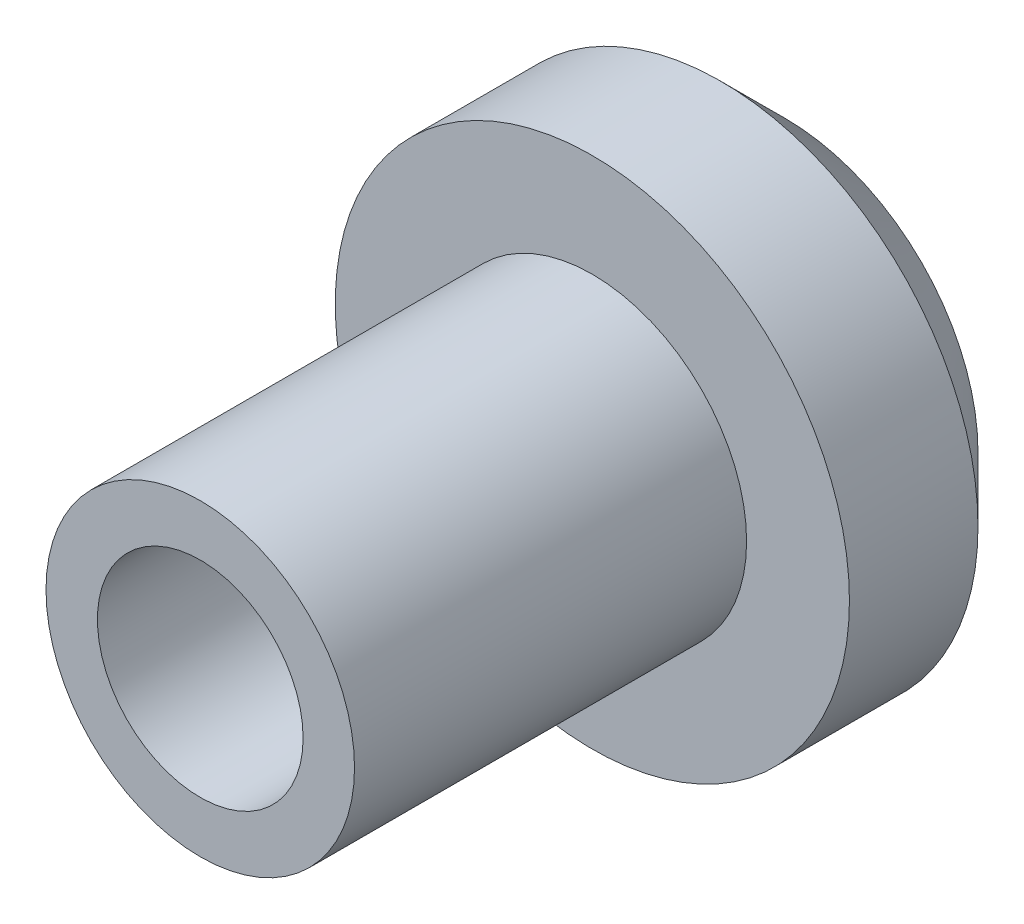
from build123d import *

# Parameters (mm, degrees)
SKETCH1_R           = 4
BOSS_EXTRUDE1_DEPTH = 3
SKETCH2_R           = 2.4
BOSS_EXTRUDE2_DEPTH = 6.1
SKETCH3_R           = 1.6
CUT_EXTRUDE1_DEPTH  = 11.714942837
CHAMFER1_SIZE       = 1


with BuildPart() as part:
    # Sketch1 → Boss-Extrude1 (new body)
    with BuildSketch(Plane.XY):
        Circle(SKETCH1_R)
    extrude(amount=BOSS_EXTRUDE1_DEPTH)

    # Sketch2 → Boss-Extrude2 (add)
    with BuildSketch(Plane.XY.offset(3)):
        Circle(SKETCH2_R)
    extrude(amount=BOSS_EXTRUDE2_DEPTH)

    # Sketch3 → Cut-Extrude1 (cut, through all)
    with BuildSketch(Plane.XY.offset(9.1)):
        Circle(SKETCH3_R)
    extrude(amount=-CUT_EXTRUDE1_DEPTH, mode=Mode.SUBTRACT)

    # Chamfer1
    chamfer1_edges = [part.edges().sort_by_distance(p)[0] for p in [
        (-4, 0, 0),
    ]]
    chamfer(chamfer1_edges, length=CHAMFER1_SIZE)


solid = part.part
